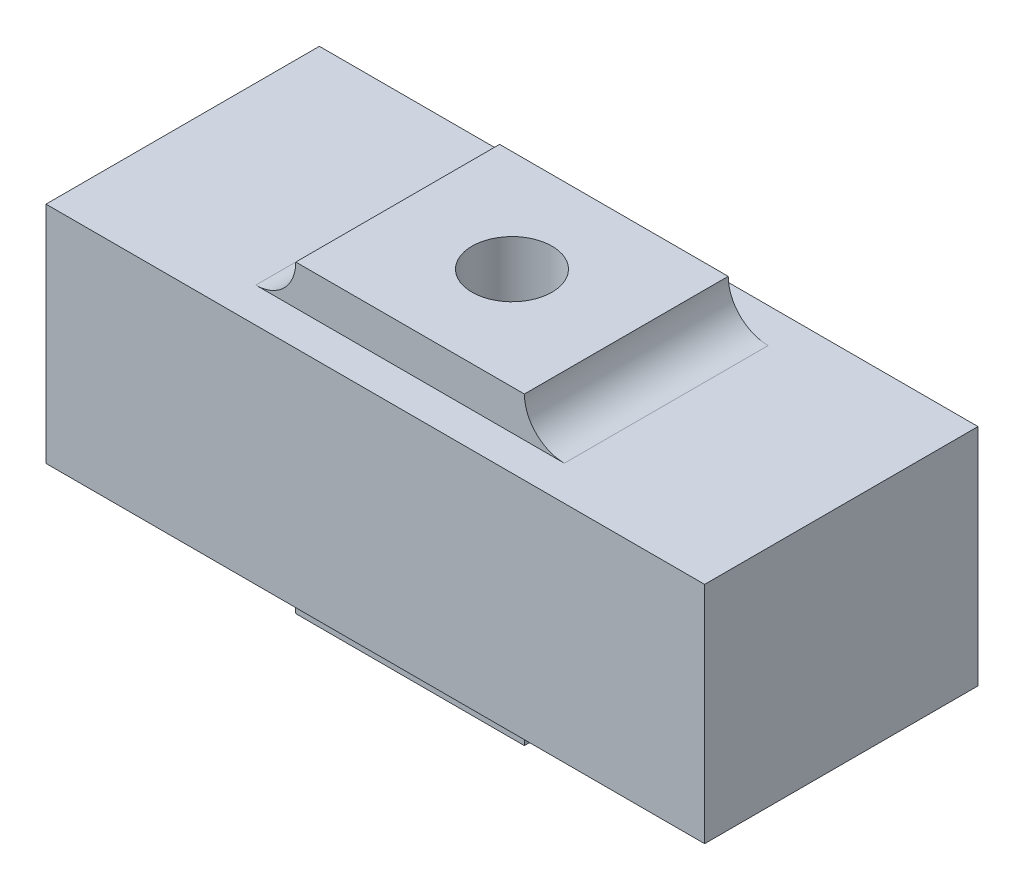
from build123d import *

# Parameters (mm, degrees)
SKETCH1_W           = 41.2
SKETCH1_H           = 17.1
BOSS_EXTRUDE1_DEPTH = 14.05
BOSS_EXTRUDE2_START = 2.5
SKETCH2_W           = 14.3
SKETCH2_H           = 12.75
BOSS_EXTRUDE2_DEPTH = 19.05
FILLET1_R           = 2.5
SKETCH3_R           = 2.5
CUT_EXTRUDE1_DEPTH  = 30.331979135


with BuildPart() as part:
    # Sketch1 → Boss-Extrude1 (new body)
    with BuildSketch(Plane(origin=(0, 0, 0), x_dir=(1, 0, 0), z_dir=(0, 1, 0))):
        Rectangle(SKETCH1_W, SKETCH1_H)
    extrude(amount=BOSS_EXTRUDE1_DEPTH)

    # Sketch2 → Boss-Extrude2 (add)
    with BuildSketch(Plane(origin=(0, 14.05, 0), x_dir=(1, 0, 0), z_dir=(0, 1, 0)).offset(BOSS_EXTRUDE2_START)):
        Rectangle(SKETCH2_W, SKETCH2_H)
    extrude(amount=-BOSS_EXTRUDE2_DEPTH)

    # Fillet1
    fillet1_edges = [part.edges().sort_by_distance(p)[0] for p in [
        (7.15, 0, 0),
        (-7.15, 0, 0),
        (-7.15, 14.05, 0),
        (7.15, 14.05, 0),
    ]]
    fillet(fillet1_edges, radius=FILLET1_R - 0.0001)  # a hair under: the kernel refuses the full size

    # Sketch3 → Cut-Extrude1 (cut, through all)
    with BuildSketch(Plane(origin=(0, 16.55, 0), x_dir=(1, 0, 0), z_dir=(0, 1, 0))):
        with Locations(Location((0, 0, 0), (0, 0, 270))):
            Circle(SKETCH3_R)
    extrude(amount=-CUT_EXTRUDE1_DEPTH, mode=Mode.SUBTRACT)


solid = part.part
